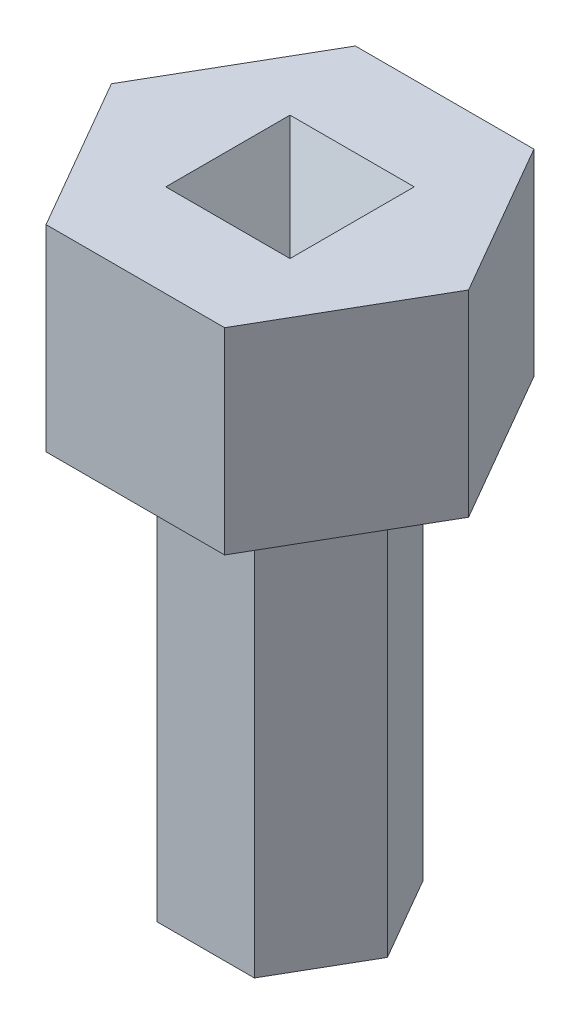
from build123d import *
from OCP.BRepFilletAPI import BRepFilletAPI_MakeChamfer

# Parameters (mm, degrees)
EXTRUDE_1_DEPTH     = 30
EXTRUDE_2_DEPTH     = 14
SKETCH_3_W          = 0.1
SKETCH_3_H          = 0.1
CUT_EXTRUDE_1_DEPTH = 12
CHAMFER_1_SIZE      = 4.367642811
CHAMFER_1_SIZE_2    = 12


with BuildPart() as part:
    # ｽｹｯﾁ1 → ﾎﾞｽ - 押し出し1 (new body)
    with BuildSketch(Plane(origin=(0, 0, 0), x_dir=(1, 0, 0), z_dir=(0, 1, 0))):
        Polygon((3.464101615, -6), (6.92820323, 0), (3.464101615, 6), (-3.464101615, 6), (-6.92820323, 0), (-3.464101615, -6), align=None)
    extrude(amount=EXTRUDE_1_DEPTH)

    # ｽｹｯﾁ2 → ﾎﾞｽ - 押し出し2 (add)
    with BuildSketch(Plane(origin=(0, 30, 0), x_dir=(1, 0, 0), z_dir=(0, 1, 0))):
        Polygon((6.350852961, -11), (12.701705922, 0), (6.350852961, 11), (-6.350852961, 11), (-12.701705922, 0), (-6.350852961, -11), align=None)
    extrude(amount=EXTRUDE_2_DEPTH)

    # ｽｹｯﾁ3 → ｶｯﾄ - 押し出し1 (cut)
    with BuildSketch(Plane(origin=(0, 44, 0), x_dir=(1, 0, 0), z_dir=(0, 1, 0))):
        Rectangle(SKETCH_3_W, SKETCH_3_H)
    extrude(amount=-CUT_EXTRUDE_1_DEPTH, mode=Mode.SUBTRACT)

    # 面取り1
    chamfer_1_edges_1 = [part.edges().sort_by_distance(p)[0] for p in [
        (0, 44, 0.05),
    ]]
    chamfer_1_side_1 = [part.faces().sort_by_distance(p)[0] for p in [
        (0, 44, 0.137352856),
    ]]
    chamfer_1_edges_2 = [part.edges().sort_by_distance(p)[0] for p in [
        (-0.05, 44, 0),
    ]]
    chamfer_1_side_2 = [part.faces().sort_by_distance(p)[0] for p in [
        (-0.137352856, 44, 0),
    ]]
    chamfer_1_edges_3 = [part.edges().sort_by_distance(p)[0] for p in [
        (0, 44, -0.05),
    ]]
    chamfer_1_side_3 = [part.faces().sort_by_distance(p)[0] for p in [
        (0, 44, -0.137352856),
    ]]
    chamfer_1_edges_4 = [part.edges().sort_by_distance(p)[0] for p in [
        (0.05, 44, 0),
    ]]
    chamfer_1_side_4 = [part.faces().sort_by_distance(p)[0] for p in [
        (0.137352856, 44, 0),
    ]]
    chamfer_1 = BRepFilletAPI_MakeChamfer(part.part.solid().wrapped)
    for e in chamfer_1_edges_1:
        chamfer_1.Add(CHAMFER_1_SIZE - 0.0001, CHAMFER_1_SIZE_2 - 0.0001, e.wrapped, chamfer_1_side_1[0].wrapped)
    for e in chamfer_1_edges_2:
        chamfer_1.Add(CHAMFER_1_SIZE - 0.0001, CHAMFER_1_SIZE_2 - 0.0001, e.wrapped, chamfer_1_side_2[0].wrapped)
    for e in chamfer_1_edges_3:
        chamfer_1.Add(CHAMFER_1_SIZE - 0.0001, CHAMFER_1_SIZE_2 - 0.0001, e.wrapped, chamfer_1_side_3[0].wrapped)
    for e in chamfer_1_edges_4:
        chamfer_1.Add(CHAMFER_1_SIZE - 0.0001, CHAMFER_1_SIZE_2 - 0.0001, e.wrapped, chamfer_1_side_4[0].wrapped)
    add(Compound.cast(chamfer_1.Shape()), mode=Mode.REPLACE)  # a hair under: the kernel refuses the full size


solid = part.part
